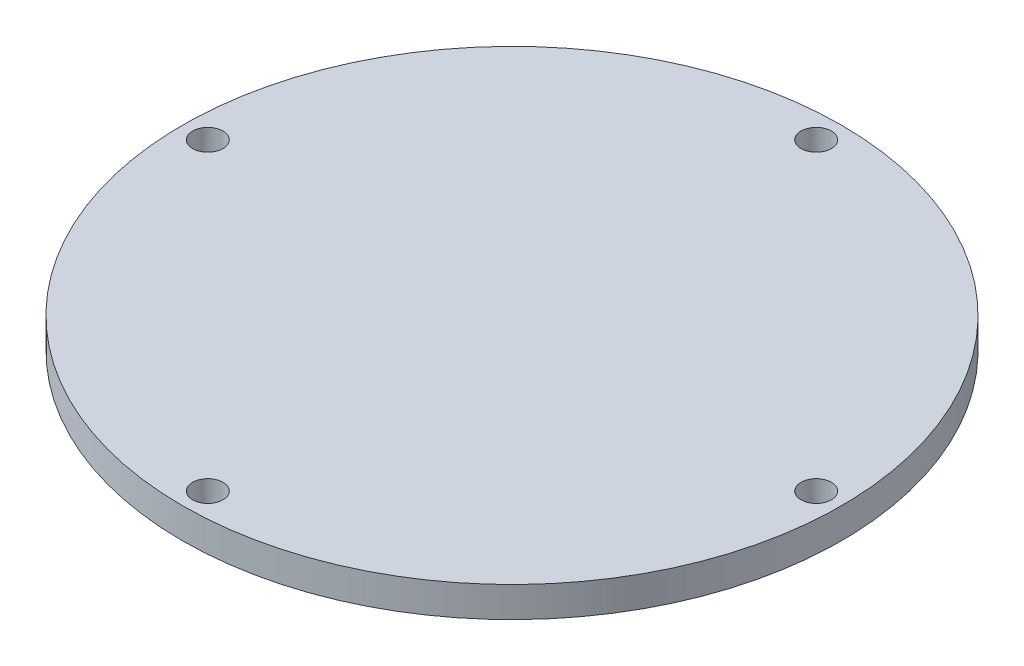
from build123d import *

# Parameters (mm, degrees)
SKETCH1_R           = 32.5
SKETCH1_R_2         = 1.5
BOSS_EXTRUDE1_DEPTH = 3


with BuildPart() as part:
    # Sketch1 → Boss-Extrude1 (new body)
    with BuildSketch(Plane(origin=(0, 0, 0), x_dir=(1, 0, 0), z_dir=(0, 1, 0))):
        Circle(SKETCH1_R)
        with Locations((-30, 0)):
            Circle(SKETCH1_R_2, mode=Mode.SUBTRACT)
        with Locations((0, 30)):
            Circle(SKETCH1_R_2, mode=Mode.SUBTRACT)
        with Locations((30, 0)):
            Circle(SKETCH1_R_2, mode=Mode.SUBTRACT)
        with Locations((0, -30)):
            Circle(SKETCH1_R_2, mode=Mode.SUBTRACT)
    extrude(amount=BOSS_EXTRUDE1_DEPTH)


solid = part.part
